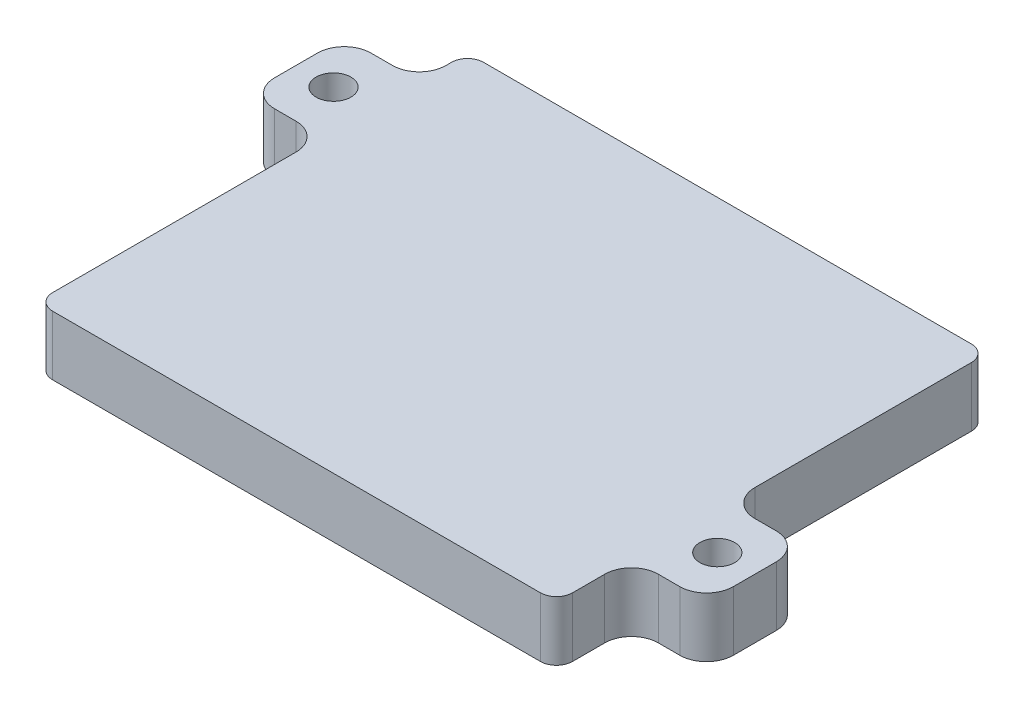
from build123d import *

# Parameters (mm, degrees)
SKETCH1_W           = 97
SKETCH1_H           = 80.401218893
BOSS_EXTRUDE1_DEPTH = 12.6
CUT_EXTRUDE2_START  = -5
CUT_EXTRUDE2_DEPTH  = 10
SKETCH6_W           = 97
SKETCH6_H           = 80.401218893
CUT_EXTRUDE3_DEPTH  = 1.5
FILLET1_R           = 3
SKETCH7_W           = 18
SKETCH7_H           = 11.1
BOSS_EXTRUDE2_DEPTH = 14
SKETCH8_W           = 18
SKETCH8_H           = 11.1
BOSS_EXTRUDE3_DEPTH = 14
FILLET2_R           = 5
SKETCH9_R           = 3.25
CUT_EXTRUDE4_DEPTH  = 80.186512346


with BuildPart() as part:
    # Sketch1 → Boss-Extrude1 (new body)
    with BuildSketch(Plane(origin=(0, 0, 0), x_dir=(1, 0, 0), z_dir=(0, 1, 0))):
        with Locations((3.433898335, -1.804923378)):
            Rectangle(SKETCH1_W, SKETCH1_H)
    extrude(amount=BOSS_EXTRUDE1_DEPTH)

    # Sketch3 → Cut-Extrude2 (cut)
    with BuildSketch(Plane(origin=(0, 12.6, 0), x_dir=(1, 0, 0), z_dir=(0, 1, 0)).offset(CUT_EXTRUDE2_START)):
        with BuildLine():
            Line((-41.366101665, 31.831649434), (-41.366101665, -34.168350566))
            ThreePointArc((-41.366101665, -34.168350566), (-40.926761836, -35.229010737), (-39.866101665, -35.668350566))
            Line((-39.866101665, -35.668350566), (46.133898335, -35.668350566))
            ThreePointArc((46.133898335, -35.668350566), (47.194558507, -35.229010737), (47.633898335, -34.168350566))
            Line((47.633898335, -34.168350566), (47.633898335, 31.831649434))
            ThreePointArc((47.633898335, 31.831649434), (47.194558507, 32.892309606), (46.133898335, 33.331649434))
            Line((46.133898335, 33.331649434), (-39.866101665, 33.331649434))
            ThreePointArc((-39.866101665, 33.331649434), (-40.926761836, 32.892309606), (-41.366101665, 31.831649434))
        make_face()
    extrude(amount=-CUT_EXTRUDE2_DEPTH, mode=Mode.SUBTRACT)

    # Sketch6 → Cut-Extrude3 (cut)
    with BuildSketch(Plane.XZ):
        with Locations((3.433898335, 1.804923378)):
            Rectangle(SKETCH6_W, SKETCH6_H)
        with BuildLine():
            Line((-39.866101665, -34.331649434), (46.133898335, -34.331649434))
            ThreePointArc((46.133898335, -34.331649434), (47.901665288, -33.599416387), (48.633898335, -31.831649434))
            Line((48.633898335, -31.831649434), (48.633898335, 34.168350566))
            ThreePointArc((48.633898335, 34.168350566), (47.901665288, 35.936117519), (46.133898335, 36.668350566))
            Line((46.133898335, 36.668350566), (-39.866101665, 36.668350566))
            ThreePointArc((-39.866101665, 36.668350566), (-41.633868617, 35.936117519), (-42.366101665, 34.168350566))
            Line((-42.366101665, 34.168350566), (-42.366101665, -31.831649434))
            ThreePointArc((-42.366101665, -31.831649434), (-41.633868617, -33.599416387), (-39.866101665, -34.331649434))
        make_face(mode=Mode.SUBTRACT)
    extrude(amount=-CUT_EXTRUDE3_DEPTH, mode=Mode.SUBTRACT)

    # Fillet1
    fillet1_edges = [part.edges().sort_by_distance(p)[0] for p in [
        (51.933898335, 7.05, -38.395686068),
        (-45.066101665, 7.05, -38.395686068),
        (-45.066101665, 7.05, 42.005532825),
        (51.933898335, 7.05, 42.005532825),
    ]]
    fillet(fillet1_edges, radius=FILLET1_R)

    # Sketch7 → Boss-Extrude2 (add)
    with BuildSketch(Plane.ZY.offset(45.066101665)):
        with Locations((-20.395686068, 7.05)):
            Rectangle(SKETCH7_W, SKETCH7_H)
    extrude(amount=BOSS_EXTRUDE2_DEPTH)

    # Sketch8 → Boss-Extrude3 (add)
    with BuildSketch(Plane(origin=(51.933898335, 0, 0), x_dir=(0, 0, -1), z_dir=(1, 0, 0))):
        with Locations((-19.005532825, 7.05)):
            Rectangle(SKETCH8_W, SKETCH8_H)
    extrude(amount=BOSS_EXTRUDE3_DEPTH)

    # Fillet2
    fillet2_edges = [part.edges().sort_by_distance(p)[0] for p in [
        (-45.066101665, 7.05, -11.395686068),
        (-59.066101665, 7.05, -11.395686068),
        (-45.066101665, 7.05, -29.395686068),
        (-59.066101665, 7.05, -29.395686068),
        (51.933898335, 7.05, 28.005532825),
        (51.933898335, 7.05, 10.005532825),
        (65.933898335, 7.05, 28.005532825),
        (65.933898335, 7.05, 10.005532825),
    ]]
    fillet(fillet2_edges, radius=FILLET2_R)

    # Sketch9 → Cut-Extrude4 (cut, through all)
    with BuildSketch(Plane(origin=(0, 12.6, 0), x_dir=(1, 0, 0), z_dir=(0, 1, 0))):
        with Locations((58.933898335, -19.005532825)):
            Circle(SKETCH9_R)
        with Locations((-52.066101665, 20.395686068)):
            Circle(SKETCH9_R)
    extrude(amount=-CUT_EXTRUDE4_DEPTH, mode=Mode.SUBTRACT)


solid = part.part
